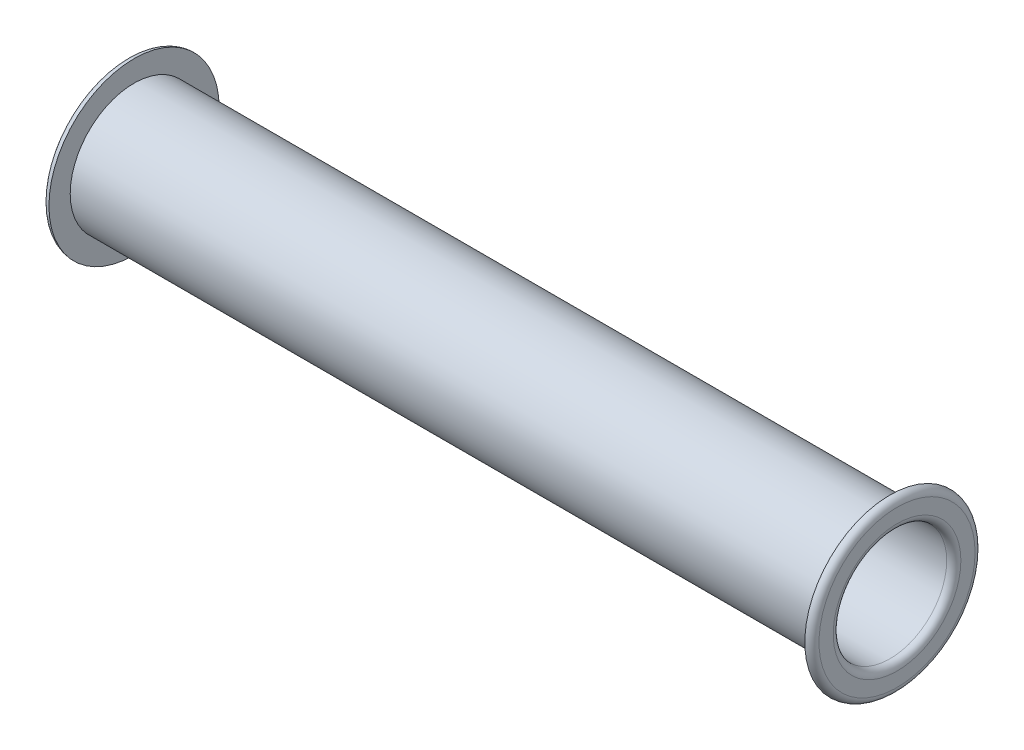
from build123d import *

# Parameters (mm, degrees)
SKETCH1_R            = 2.286
EXTRUDE1_DEPTH       = 13.53185
SKETCH2_R            = 3.048
EXTRUDE2_DEPTH       = 0.254
FILLET1_R            = 0.254
FILLET1_OF_MIRROR1_R = 0.254
SKETCH3_R            = 2.032
CUT_EXTRUDE1_DEPTH   = 28.9066167
FILLET2_R            = 0.254


with BuildPart() as part:
    # Sketch1 → Extrude1 (new, symmetric)
    with BuildSketch(Plane(origin=(0, 0, 0), x_dir=(0, 0, -1), z_dir=(1, 0, 0))):
        with Locations(Location((0, 0, 0), (0, 0, 180))):
            Circle(SKETCH1_R)
    extrude(amount=EXTRUDE1_DEPTH, both=True)

    # Sketch2 → Extrude2 (add)
    with BuildSketch(Plane(origin=(13.53185, 0, 0), x_dir=(0, 0, -1), z_dir=(1, 0, 0))):
        Circle(SKETCH2_R)
    extrude2 = extrude(amount=EXTRUDE2_DEPTH)

    # Fillet1
    fillet1_edges = [part.edges().sort_by_distance(p)[0] for p in [
        (13.78585, 0, 3.048),
    ]]
    fillet(fillet1_edges, radius=FILLET1_R - 0.0001)  # a hair under: the kernel refuses the full size

    # Mirror1: Extrude2 across plane
    add(extrude2.mirror(Plane(origin=(0, 0, 0), x_dir=(0, 0, 1), z_dir=(1, 0, 0))))

    # Fillet1 of Mirror1
    fillet1_of_mirror1_edges = [part.edges().sort_by_distance(p)[0] for p in [
        (-13.78585, 0, 3.048),
    ]]
    fillet(fillet1_of_mirror1_edges, radius=FILLET1_OF_MIRROR1_R - 0.0001)  # a hair under: the kernel refuses the full size

    # Sketch3 → Cut-Extrude1 (cut, through all)
    with BuildSketch(Plane(origin=(13.78585, 0, 0), x_dir=(0, 0, -1), z_dir=(1, 0, 0))):
        Circle(SKETCH3_R)
    extrude(amount=-CUT_EXTRUDE1_DEPTH, mode=Mode.SUBTRACT)

    # Fillet2
    fillet2_edges = [part.edges().sort_by_distance(p)[0] for p in [
        (-13.78585, 0, 2.032),
        (13.78585, 0, 2.032),
    ]]
    fillet(fillet2_edges, radius=FILLET2_R)


solid = part.part
